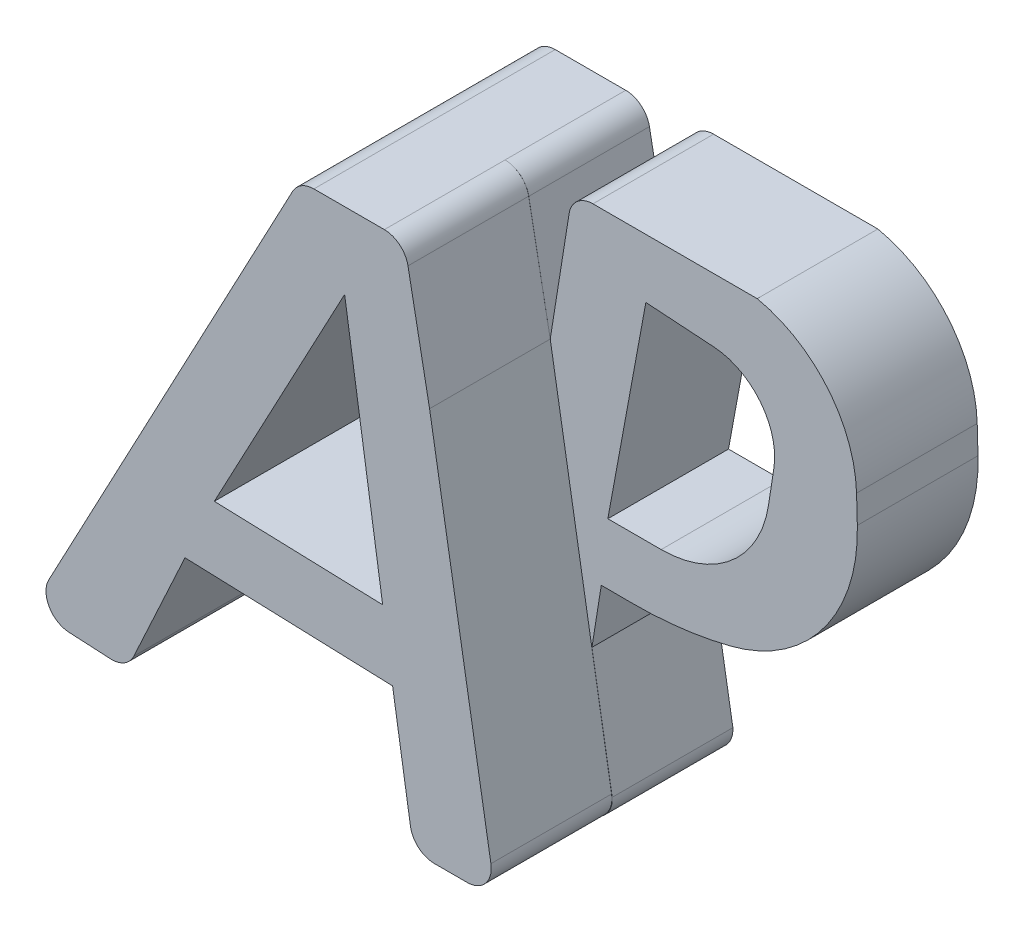
from build123d import *

# Parameters (mm, degrees)
BOSS_EXTRUDE1_DEPTH = 2
BOSS_EXTRUDE3_DEPTH = 2


# Read off the part's stored shape, not the designer's step: Boss-Extrude3
with BuildPart() as part:
    # Sketch1 → Boss-Extrude1 (new body)
    with BuildSketch(Plane.XY):
        with BuildLine():
            Line((10.921700045, 15.820627971), (11.277420096, 13.949291525))
            Line((11.277420096, 13.949291525), (11.590342055, 15.907424067))
            ThreePointArc((11.590342055, 15.907424067), (11.725761981, 16.148644901), (11.985330235, 16.244302459))
            Line((11.985330235, 16.244302459), (14.707676179, 16.244302459))
            ThreePointArc((14.707676179, 16.244302459), (15.872864002, 15.546401169), (16.35465827, 14.27651804))
            Line((16.35465827, 14.27651804), (16.367622155, 13.819582081))
            ThreePointArc((16.367622155, 13.819582081), (15.803130226, 12.056353518), (14.259159222, 11.034698173))
            ThreePointArc((14.259159222, 11.034698173), (13.45100908, 10.884495001), (12.630428485, 10.836379176))
            Line((12.630428485, 10.836379176), (12.123518451, 10.838420989))
            Line((12.123518451, 10.838420989), (11.968610095, 9.869070376))
            Line((11.968610095, 9.869070376), (12.30473343, 7.884872777))
            ThreePointArc((12.30473343, 7.884872777), (12.19685885, 7.586331563), (11.905484198, 7.460376837))
            Line((11.905484198, 7.460376837), (10.999839261, 7.460376837))
            Line((10.999839261, 7.460376837), (10.724808345, 7.460376837))
            ThreePointArc((10.724808345, 7.460376837), (10.4163856, 7.605670319), (10.332021927, 7.935999785))
            Line((10.332021927, 7.935999785), (10.664596921, 9.663397929))
            Line((10.664596921, 9.663397929), (7.22360923, 9.783007686))
            Line((7.22360923, 9.783007686), (6.375331355, 7.946169859))
            ThreePointArc((6.375331355, 7.946169859), (6.218562023, 7.771225984), (5.990616105, 7.714457672))
            Line((5.990616105, 7.714457672), (5.298180624, 7.751850988))
            ThreePointArc((5.298180624, 7.751850988), (4.97142736, 7.954619126), (4.966617202, 8.339144126))
            Line((4.966617202, 8.339144126), (9.007156407, 15.933805165))
            ThreePointArc((9.007156407, 15.933805165), (9.1543162, 16.08882219), (9.36028944, 16.145930044))
            Line((9.36028944, 16.145930044), (10.528736663, 16.145930044))
            ThreePointArc((10.528736663, 16.145930044), (10.783806094, 16.054052723), (10.921700045, 15.820627971))
        make_face()
        with BuildLine():
            Line((12.232297108, 11.847227843), (12.862297108, 15.267227843))
            Line((12.862297108, 15.267227843), (13.989185775, 15.191954828))
            ThreePointArc((13.989185775, 15.191954828), (14.760146227, 14.789523159), (14.98451661, 13.949291525))
            Line((14.98451661, 13.949291525), (14.895254355, 13.372120047))
            ThreePointArc((14.895254355, 13.372120047), (14.287898045, 12.28062731), (13.116402, 11.847227843))
            Line((13.116402, 11.847227843), (12.232297108, 11.847227843))
        make_face(mode=Mode.SUBTRACT)
        Polygon((9.869863773, 14.885930044), (10.499863773, 10.745930044), (7.709863773, 10.835930044), align=None, mode=Mode.SUBTRACT)
    extrude(amount=BOSS_EXTRUDE1_DEPTH)

    # Boss-Extrude3 outline → Boss-Extrude3 (add)
    with BuildSketch(Plane.XY.offset(2)):
        with BuildLine():
            Line((10.528736641, 16.145925468), (9.36028944, 16.145930044))
            ThreePointArc((9.36028944, 16.145930044), (9.1543162, 16.08882219), (9.007156407, 15.933805165))
            Line((9.007156407, 15.933805165), (4.966617202, 8.339144126))
            ThreePointArc((4.966617202, 8.339144126), (4.97142736, 7.954619126), (5.298180624, 7.751850988))
            Line((5.298180624, 7.751850988), (5.990616105, 7.714457672))
            ThreePointArc((5.990616105, 7.714457672), (6.218562023, 7.771225984), (6.375331355, 7.946169859))
            Line((6.375331355, 7.946169859), (7.22360923, 9.783007686))
            Line((7.22360923, 9.783007686), (10.664596921, 9.663397929))
            Line((10.664596921, 9.663397929), (10.960889342, 7.797640802))
            ThreePointArc((10.960889342, 7.797640802), (11.096222191, 7.556161112), (11.355938946, 7.460376837))
            Line((11.355938946, 7.460376837), (11.905483631, 7.460416896))
            ThreePointArc((11.905483631, 7.460416896), (12.207123715, 7.604318029), (12.294240301, 7.926971058))
            Line((12.294240301, 7.926971058), (11.277420096, 13.949291525))
            Line((11.277420096, 13.949291525), (10.919712975, 15.821015565))
            ThreePointArc((10.919712975, 15.821015565), (10.782477337, 16.05356798), (10.528736641, 16.145925468))
        make_face()
        Polygon((10.499863773, 10.745930044), (7.709863773, 10.835930044), (9.869863773, 14.885930044), align=None, mode=Mode.SUBTRACT)
    extrude(amount=BOSS_EXTRUDE3_DEPTH)


solid = part.part
